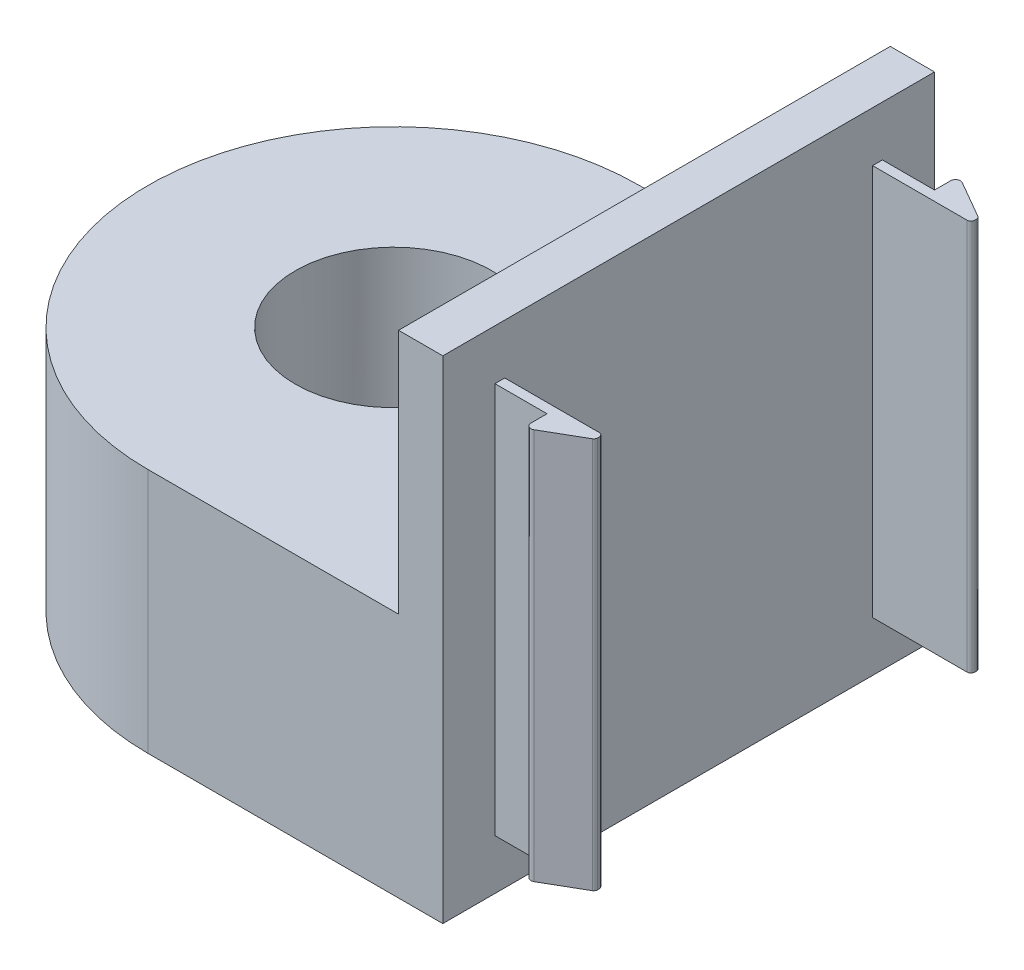
from build123d import *

# Parameters (mm, degrees)
BOSS_EXTRUDE2_DEPTH = 50
CUT_EXTRUDE1_START  = -25
CUT_EXTRUDE1_DEPTH  = 25
SKETCH5_R           = 10
CUT_EXTRUDE3_DEPTH  = 76
SKETCH10_R          = 15
CUT_EXTRUDE4_DEPTH  = 5
SKETCH17_W          = 50
SKETCH17_H          = 5.1
CUT_EXTRUDE5_DEPTH  = 90.582364336
FILLET1_R           = 0.4
FILLET2_R           = 0.5


with BuildPart() as part:
    # Sketch3 → Boss-Extrude2 (new body)
    with BuildSketch(Plane(origin=(0, 0, 0), x_dir=(1, 0, 0), z_dir=(0, 1, 0))):
        with BuildLine():
            Line((5, 44.7), (10.3, 44.7))
            Line((10.3, 44.7), (10.3, 47.2))
            Line((10.3, 47.2), (15, 44.486453735))
            Line((15, 44.486453735), (15, 43.7))
            Line((15, 43.7), (5, 43.7))
            Line((5, 43.7), (5, 6.3))
            Line((5, 6.3), (15, 6.3))
            Line((15, 6.3), (15, 5.513546265))
            Line((15, 5.513546265), (10.3, 2.8))
            Line((10.3, 2.8), (10.3, 5.3))
            Line((10.3, 5.3), (5, 5.3))
            Line((5, 5.3), (5, 0))
            Line((5, 0), (0, 0))
            Line((0, 0), (-25, 0))
            ThreePointArc((-25, 0), (-50, 25), (-25, 50))
            Line((-25, 50), (0, 50))
            Line((0, 50), (5, 50))
            Line((5, 50), (5, 44.7))
        make_face()
    extrude(amount=BOSS_EXTRUDE2_DEPTH)

    # Sketch4 → Cut-Extrude1 (cut)
    with BuildSketch(Plane(origin=(0, 50, 0), x_dir=(1, 0, 0), z_dir=(0, 1, 0)).offset(CUT_EXTRUDE1_START)):
        with BuildLine():
            Line((-25, 0), (0, 0))
            Line((0, 0), (0.5, 0))
            Line((0.5, 0), (0.5, 50))
            Line((0.5, 50), (0, 50))
            Line((0, 50), (-25, 50))
            ThreePointArc((-25, 50), (-42.67766953, 42.67766953), (-50, 25))
            ThreePointArc((-50, 25), (-42.67766953, 7.32233047), (-25, 0))
        make_face()
    extrude(amount=CUT_EXTRUDE1_DEPTH, mode=Mode.SUBTRACT)

    # Sketch5 → Cut-Extrude3 (cut, through all)
    with BuildSketch(Plane(origin=(0, 25, 0), x_dir=(1, 0, 0), z_dir=(0, 1, 0))):
        with Locations((-25, 25)):
            Circle(SKETCH5_R)
    extrude(amount=-CUT_EXTRUDE3_DEPTH, mode=Mode.SUBTRACT)

    # Sketch10 → Cut-Extrude4 (cut)
    with BuildSketch(Plane.XZ):
        with Locations((-25, -25)):
            Circle(SKETCH10_R)
    extrude(amount=-CUT_EXTRUDE4_DEPTH, mode=Mode.SUBTRACT)

    # Sketch17 → Cut-Extrude5 (cut, through all)
    with BuildSketch(Plane(origin=(5, 0, 0), x_dir=(0, 0, -1), z_dir=(1, 0, 0))):
        with Locations((25, 47.45)):
            Rectangle(SKETCH17_W, SKETCH17_H)
        with Locations((25, 2.55)):
            Rectangle(SKETCH17_W, SKETCH17_H)
    extrude(amount=CUT_EXTRUDE5_DEPTH, mode=Mode.SUBTRACT)

    # Fillet1
    fillet1_edges = [part.edges().sort_by_distance(p)[0] for p in [
        (15, 25, -43.7),
        (15, 25, -44.486453735),
        (15, 25, -6.3),
        (15, 25, -5.513546265),
    ]]
    fillet(fillet1_edges, radius=FILLET1_R)

    # Fillet2
    fillet2_edges = [part.edges().sort_by_distance(p)[0] for p in [
        (10.3, 25, -47.2),
        (10.3, 25, -2.8),
    ]]
    fillet(fillet2_edges, radius=FILLET2_R)


solid = part.part
